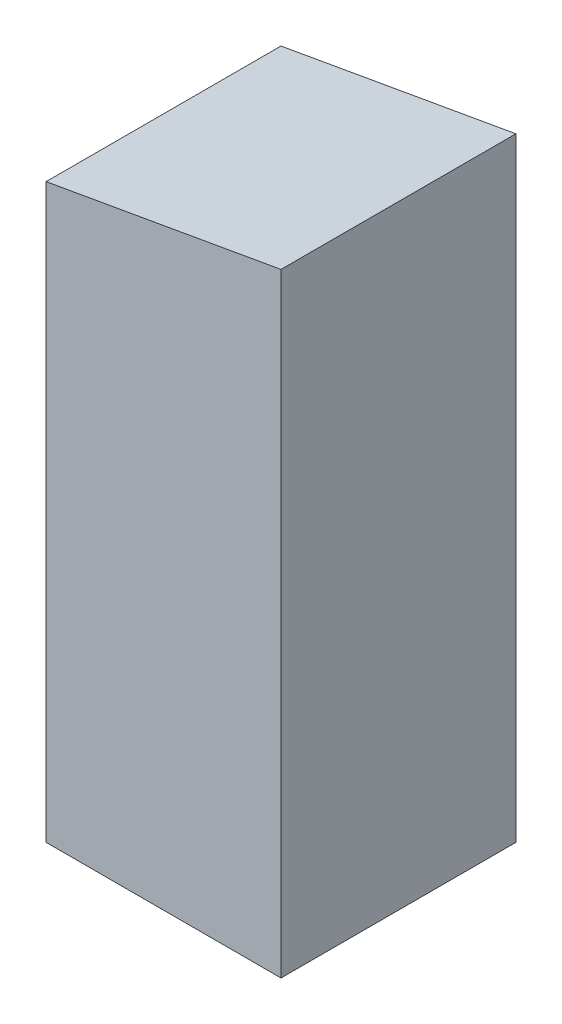
from build123d import *

# Parameters (mm, degrees)
SKETCH1_W           = 88.9
SKETCH1_H           = 88.9
BOSS_EXTRUDE1_DEPTH = 232.24
CUT_EXTRUDE1_DEPTH  = 135


with BuildPart() as part:
    # Sketch1 → Boss-Extrude1 (new body)
    with BuildSketch(Plane(origin=(0, 0, 0), x_dir=(1, 0, 0), z_dir=(0, 1, 0))):
        Rectangle(SKETCH1_W, SKETCH1_H)
    extrude(amount=BOSS_EXTRUDE1_DEPTH)

    # Sketch2 → Cut-Extrude1 (cut)
    with BuildSketch(Plane.XY.offset(44.45)):
        Polygon((44.45, 232.24), (-44.45, 216.564531415), (-44.45, 232.24), align=None)
    extrude(amount=-CUT_EXTRUDE1_DEPTH, mode=Mode.SUBTRACT)


solid = part.part
